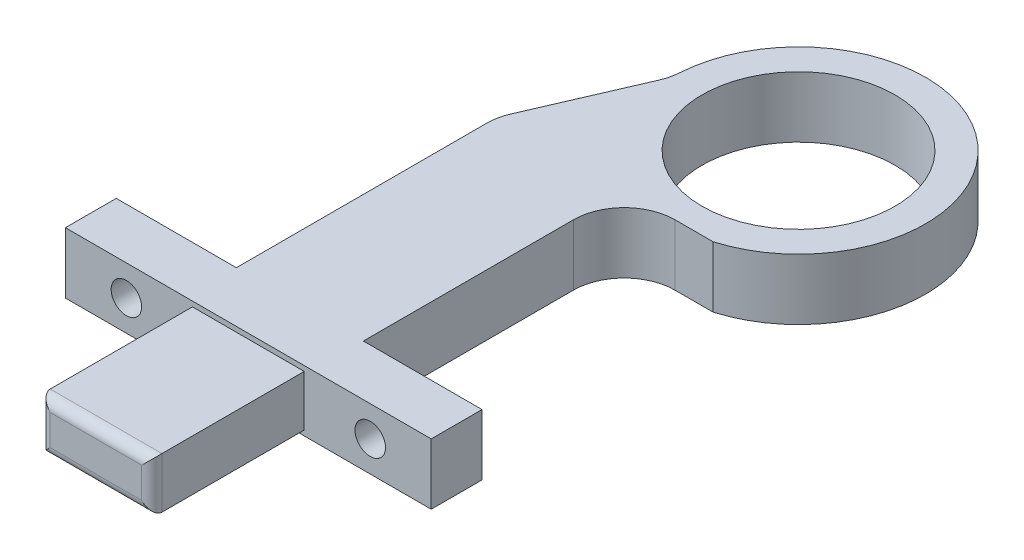
from build123d import *

# Parameters (mm, degrees)
CROQUIS1_R              = 9.5
SALIENTE_EXTRUIR1_DEPTH = 6
CROQUIS2_R              = 1.5
CORTAR_EXTRUIR1_DEPTH   = 6
CROQUIS3_W              = 11
CROQUIS3_H              = 15
CORTAR_EXTRUIR2_DEPTH   = 0.5
CROQUIS4_W              = 11
CROQUIS4_H              = 15
CORTAR_EXTRUIR3_DEPTH   = 0.5
REDONDEO1_R             = 1


with BuildPart() as part:
    # Croquis1 → Saliente-Extruir1 (new body)
    with BuildSketch(Plane(origin=(0, 0, 0), x_dir=(1, 0, 0), z_dir=(0, 1, 0))):
        with BuildLine():
            Line((-25.374701647, 20.783734094), (-29.767291136, 10.621141392))
            ThreePointArc((-29.767291136, 10.621141392), (-29.942112128, 10.153967486), (-30.069514751, 9.671699501))
            ThreePointArc((-30.069514751, 9.671699501), (-30.150557328, 9.157351254), (-30.17766953, 8.637363805))
            Line((-30.17766953, 8.637363805), (-30.17766953, -16))
            Line((-30.17766953, -16), (-42, -16))
            Line((-42, -16), (-42, -21))
            Line((-42, -21), (-29.5, -21))
            Line((-29.5, -21), (-29.5, -36))
            Line((-29.5, -36), (-18.5, -36))
            Line((-18.5, -36), (-18.5, -21))
            Line((-18.5, -21), (-6, -21))
            Line((-6, -21), (-6, -16))
            Line((-6, -16), (-17.67766953, -16))
            Line((-17.67766953, -16), (-17.67766953, 4.671699501))
            ThreePointArc((-17.67766953, 4.671699501), (-16.213203436, 8.207233407), (-12.67766953, 9.671699501))
            Line((-12.67766953, 9.671699501), (-8.928571429, 9.671699501))
            ThreePointArc((-8.928571429, 9.671699501), (-4.713647249, 31.429321655), (-24.974516609, 22.448404084))
            ThreePointArc((-24.974516609, 22.448404084), (-25.102827296, 21.598812807), (-25.374701647, 20.783734094))
        make_face()
        with Locations((-12.5, 21.650635095)):
            Circle(CROQUIS1_R, mode=Mode.SUBTRACT)
    extrude(amount=SALIENTE_EXTRUIR1_DEPTH)

    # Croquis2 → Cortar-Extruir1 (cut)
    with BuildSketch(Plane.XY.offset(21)):
        with Locations((-36, 3)):
            Circle(CROQUIS2_R)
        with Locations((-12, 3)):
            Circle(CROQUIS2_R)
    extrude(amount=-CORTAR_EXTRUIR1_DEPTH, mode=Mode.SUBTRACT)

    # Croquis3 → Cortar-Extruir2 (cut)
    with BuildSketch(Plane(origin=(0, 6, 0), x_dir=(1, 0, 0), z_dir=(0, 1, 0))):
        with Locations((-24, -28.5)):
            Rectangle(CROQUIS3_W, CROQUIS3_H)
    extrude(amount=-CORTAR_EXTRUIR2_DEPTH, mode=Mode.SUBTRACT)

    # Croquis4 → Cortar-Extruir3 (cut)
    with BuildSketch(Plane.XZ):
        with Locations((-24, 28.5)):
            Rectangle(CROQUIS4_W, CROQUIS4_H)
    extrude(amount=-CORTAR_EXTRUIR3_DEPTH, mode=Mode.SUBTRACT)

    # Redondeo1
    redondeo1_edges = [part.edges().sort_by_distance(p)[0] for p in [
        (-29.5, 3, 36),
        (-24, 5.5, 36),
        (-18.5, 3, 36),
        (-24, 0.5, 36),
    ]]
    fillet(redondeo1_edges, radius=REDONDEO1_R)


solid = part.part
